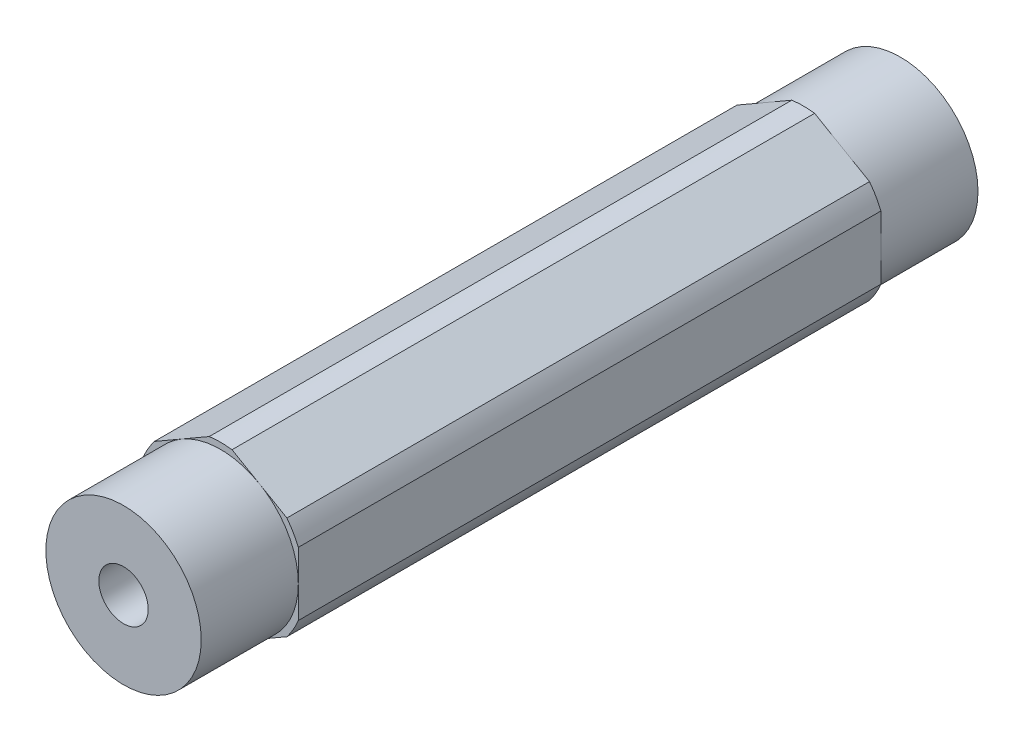
from build123d import *

# Parameters (mm, degrees)
SKETCH1_R           = 2.0193
BOSS_EXTRUDE1_DEPTH = 23.8125
SKETCH2_R           = 6.35
SKETCH2_R_2         = 2.0193
BOSS_EXTRUDE2_DEPTH = 7.9375


with BuildPart() as part:
    # Sketch1 → Boss-Extrude1 (new, symmetric)
    with BuildSketch(Plane.XY):
        with BuildLine():
            ThreePointArc((0.93173274, 6.79441227), (0, 6.858), (-0.93173274, 6.79441227))
            Line((-0.93173274, 6.79441227), (-5.41826726, 4.204110358))
            ThreePointArc((-5.41826726, 4.204110358), (-5.939202219, 3.429), (-6.35, 2.590301913))
            Line((-6.35, 2.590301913), (-6.35, -2.590301913))
            ThreePointArc((-6.35, -2.590301913), (-5.939202219, -3.429), (-5.41826726, -4.204110358))
            Line((-5.41826726, -4.204110358), (-0.93173274, -6.79441227))
            ThreePointArc((-0.93173274, -6.79441227), (0, -6.858), (0.93173274, -6.79441227))
            Line((0.93173274, -6.79441227), (5.41826726, -4.204110358))
            ThreePointArc((5.41826726, -4.204110358), (5.939202219, -3.429), (6.35, -2.590301913))
            Line((6.35, -2.590301913), (6.35, 2.590301913))
            ThreePointArc((6.35, 2.590301913), (5.939202219, 3.429), (5.41826726, 4.204110358))
            Line((5.41826726, 4.204110358), (0.93173274, 6.79441227))
        make_face()
        Circle(SKETCH1_R, mode=Mode.SUBTRACT)
    extrude(amount=BOSS_EXTRUDE1_DEPTH, both=True)

    # Sketch2 → Boss-Extrude2 (add)
    with BuildSketch(Plane.XY.offset(23.8125)):
        Circle(SKETCH2_R)
        Circle(SKETCH2_R_2, mode=Mode.SUBTRACT)
    boss_extrude2 = extrude(amount=BOSS_EXTRUDE2_DEPTH)

    # Mirror1: Boss-Extrude2 across plane
    add(boss_extrude2.mirror(Plane.XY))


solid = part.part
